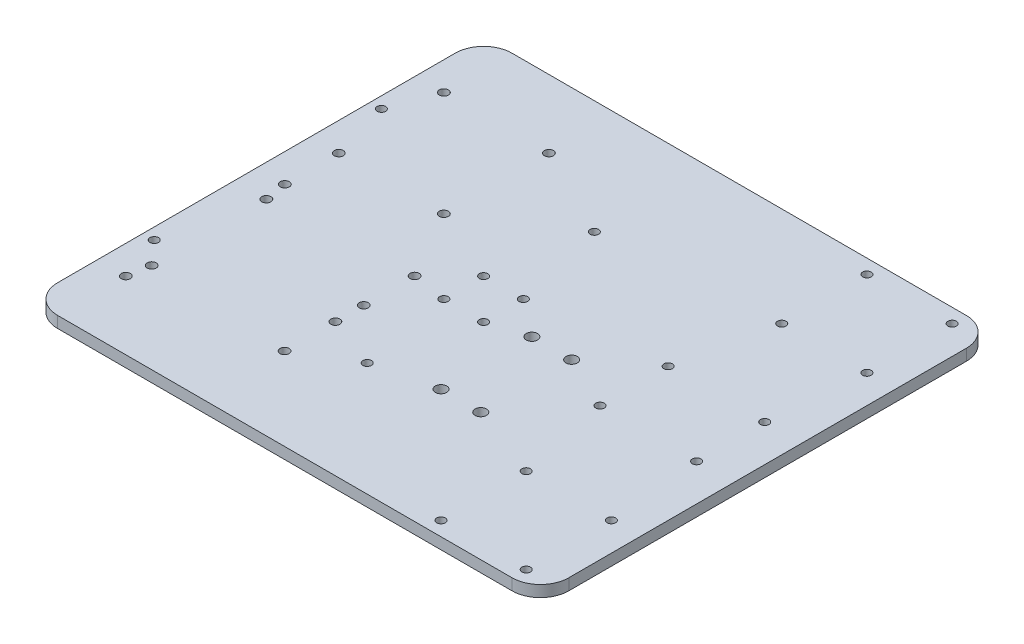
from build123d import *

# Parameters (mm, degrees)
SKETCH_1_W                  = 180
SKETCH_1_H                  = 160
EXTRUDE_1_DEPTH             = 4
SKETCH_4_R                  = 1.6
CUT_EXTRUDE_3_DEPTH         = 4
SKETCH_5_R                  = 1.6
CUT_EXTRUDE_4_DEPTH         = 4
SKETCH_7_R                  = 2
CUT_EXTRUDE_5_DEPTH         = 10
FILLET_1_R                  = 10
SKETCH_8_R                  = 1.5
CUT_EXTRUDE_6_DEPTH         = 10
SKETCH_11_R                 = 1.5
CUT_EXTRUDE_8_DEPTH         = 4
SKETCH_12_R                 = 1.5
CUT_EXTRUDE_9_DEPTH         = 4
SKETCH_13_R                 = 1.5
CUT_EXTRUDE_10_DEPTH        = 10
PATTERN_LINEAR_1_COUNT      = 2
PATTERN_LINEAR_1_PITCH      = 30
PATTERN_LINEAR_1_COUNT_DIR2 = 2
PATTERN_LINEAR_1_PITCH_DIR2 = 30
MIRROR_1_COPY_1_SKETCH_R    = 1.5
MIRROR_1_COPY_1_DEPTH       = 10
MIRROR_1_COPY_2_SKETCH_R    = 1.5
MIRROR_1_COPY_2_DEPTH       = 10
MIRROR_1_COPY_3_SKETCH_R    = 1.5
MIRROR_1_COPY_3_DEPTH       = 10
MIRROR_1_COPY_4_SKETCH_R    = 1.5
MIRROR_1_COPY_4_DEPTH       = 10


with BuildPart() as part:
    # 草图1 → 凸台-拉伸1 (new body)
    with BuildSketch(Plane(origin=(0, 0, 0), x_dir=(1, 0, 0), z_dir=(0, 1, 0))):
        Rectangle(SKETCH_1_W, SKETCH_1_H)
    extrude(amount=EXTRUDE_1_DEPTH)

    # 草图4 → 切除-拉伸3 (cut)
    with BuildSketch(Plane(origin=(0, 4, 0), x_dir=(1, 0, 0), z_dir=(0, 1, 0))):
        with Locations((-80, 56)):
            Circle(SKETCH_4_R)
        with Locations((-43, 56)):
            Circle(SKETCH_4_R)
        with Locations((-43, 19)):
            Circle(SKETCH_4_R)
        with Locations((-80, 19)):
            Circle(SKETCH_4_R)
    extrude(amount=-CUT_EXTRUDE_3_DEPTH, mode=Mode.SUBTRACT)

    # 草图5 → 切除-拉伸4 (cut)
    with BuildSketch(Plane(origin=(0, 4, 0), x_dir=(1, 0, 0), z_dir=(0, 1, 0))):
        with Locations((-78.7, -7.8)):
            Circle(SKETCH_5_R)
        with Locations((-29.2, -23)):
            Circle(SKETCH_5_R)
        with Locations((-29.2, -50.9)):
            Circle(SKETCH_5_R)
        with Locations((-80, -56)):
            Circle(SKETCH_5_R)
        with Locations((-29.2, -5.1)):
            Circle(SKETCH_5_R)
        with Locations((-29.2, -33)):
            Circle(SKETCH_5_R)
        with Locations((-80, 0)):
            Circle(SKETCH_5_R)
        with Locations((-78.7, -48.2)):
            Circle(SKETCH_5_R)
    extrude(amount=-CUT_EXTRUDE_4_DEPTH, mode=Mode.SUBTRACT)

    # 草图7 → 切除-拉伸5 (cut)
    with BuildSketch(Plane.XZ):
        with Locations((24, 35)):
            Circle(SKETCH_7_R)
        with Locations((10, 35)):
            Circle(SKETCH_7_R)
        with Locations((24, 3)):
            Circle(SKETCH_7_R)
        with Locations((10, 3)):
            Circle(SKETCH_7_R)
    extrude(amount=-CUT_EXTRUDE_5_DEPTH, mode=Mode.SUBTRACT)

    # 圆角1
    fillet_1_edges = [part.edges().sort_by_distance(p)[0] for p in [
        (90, 2, 80),
        (90, 2, -80),
        (-90, 2, -80),
        (-90, 2, 80),
    ]]
    fillet(fillet_1_edges, radius=FILLET_1_R)

    # 草图8 → 切除-拉伸6 (cut)
    with BuildSketch(Plane.XZ):
        with Locations((-17, 7)):
            Circle(SKETCH_8_R)
        with Locations((-3, 7)):
            Circle(SKETCH_8_R)
        with Locations((-17, -7)):
            Circle(SKETCH_8_R)
        with Locations((-3, -7)):
            Circle(SKETCH_8_R)
    extrude(amount=-CUT_EXTRUDE_6_DEPTH, mode=Mode.SUBTRACT)

    # 草图11 → 切除-拉伸8 (cut)
    with BuildSketch(Plane.XZ):
        with Locations((77, 12)):
            Circle(SKETCH_11_R)
        with Locations((43, 12)):
            Circle(SKETCH_11_R)
        with Locations((77, -12)):
            Circle(SKETCH_11_R)
        with Locations((43, -12)):
            Circle(SKETCH_11_R)
    extrude(amount=-CUT_EXTRUDE_8_DEPTH, mode=Mode.SUBTRACT)

    # 草图12 → 切除-拉伸9 (cut)
    with BuildSketch(Plane.XZ):
        with Locations((-86, 40)):
            Circle(SKETCH_12_R)
        with Locations((-11, 40)):
            Circle(SKETCH_12_R)
        with Locations((-11, -40)):
            Circle(SKETCH_12_R)
        with Locations((-86, -40)):
            Circle(SKETCH_12_R)
    extrude(amount=-CUT_EXTRUDE_9_DEPTH, mode=Mode.SUBTRACT)

    # 草图13 → 切除-拉伸10 (cut)
    with BuildSketch(Plane(origin=(0, 4, 0), x_dir=(1, 0, 0), z_dir=(0, 1, 0))):
        with Locations((80, 75)):
            Circle(SKETCH_13_R)
    cut_extrude_10 = extrude(amount=-CUT_EXTRUDE_10_DEPTH, mode=Mode.SUBTRACT)

    # 阵列(线性)1: Cut-Extrude 10 2 × 2
    with Locations(*[(-i * PATTERN_LINEAR_1_PITCH, 0, j * PATTERN_LINEAR_1_PITCH_DIR2) for i in range(PATTERN_LINEAR_1_COUNT) for j in range(PATTERN_LINEAR_1_COUNT_DIR2) if (i, j) != (0, 0)]):
        add(cut_extrude_10, mode=Mode.SUBTRACT)

    # 镜向1 copy 1 sketch → 镜向1 copy 1 (cut)
    with BuildSketch(Plane(origin=(0, 4, -30), x_dir=(1, 0, 0), z_dir=(0, 1, 0))):
        with Locations((80, -75)):
            Circle(MIRROR_1_COPY_1_SKETCH_R)
    extrude(amount=-MIRROR_1_COPY_1_DEPTH, mode=Mode.SUBTRACT)

    # 镜向1 copy 2 sketch → 镜向1 copy 2 (cut)
    with BuildSketch(Plane(origin=(-30, 4, 0), x_dir=(1, 0, 0), z_dir=(0, 1, 0))):
        with Locations((80, -75)):
            Circle(MIRROR_1_COPY_2_SKETCH_R)
    extrude(amount=-MIRROR_1_COPY_2_DEPTH, mode=Mode.SUBTRACT)

    # 镜向1 copy 3 sketch → 镜向1 copy 3 (cut)
    with BuildSketch(Plane(origin=(-30, 4, -30), x_dir=(1, 0, 0), z_dir=(0, 1, 0))):
        with Locations((80, -75)):
            Circle(MIRROR_1_COPY_3_SKETCH_R)
    extrude(amount=-MIRROR_1_COPY_3_DEPTH, mode=Mode.SUBTRACT)

    # 镜向1 copy 4 sketch → 镜向1 copy 4 (cut)
    with BuildSketch(Plane(origin=(0, 4, 0), x_dir=(1, 0, 0), z_dir=(0, 1, 0))):
        with Locations((80, -75)):
            Circle(MIRROR_1_COPY_4_SKETCH_R)
    extrude(amount=-MIRROR_1_COPY_4_DEPTH, mode=Mode.SUBTRACT)


solid = part.part
